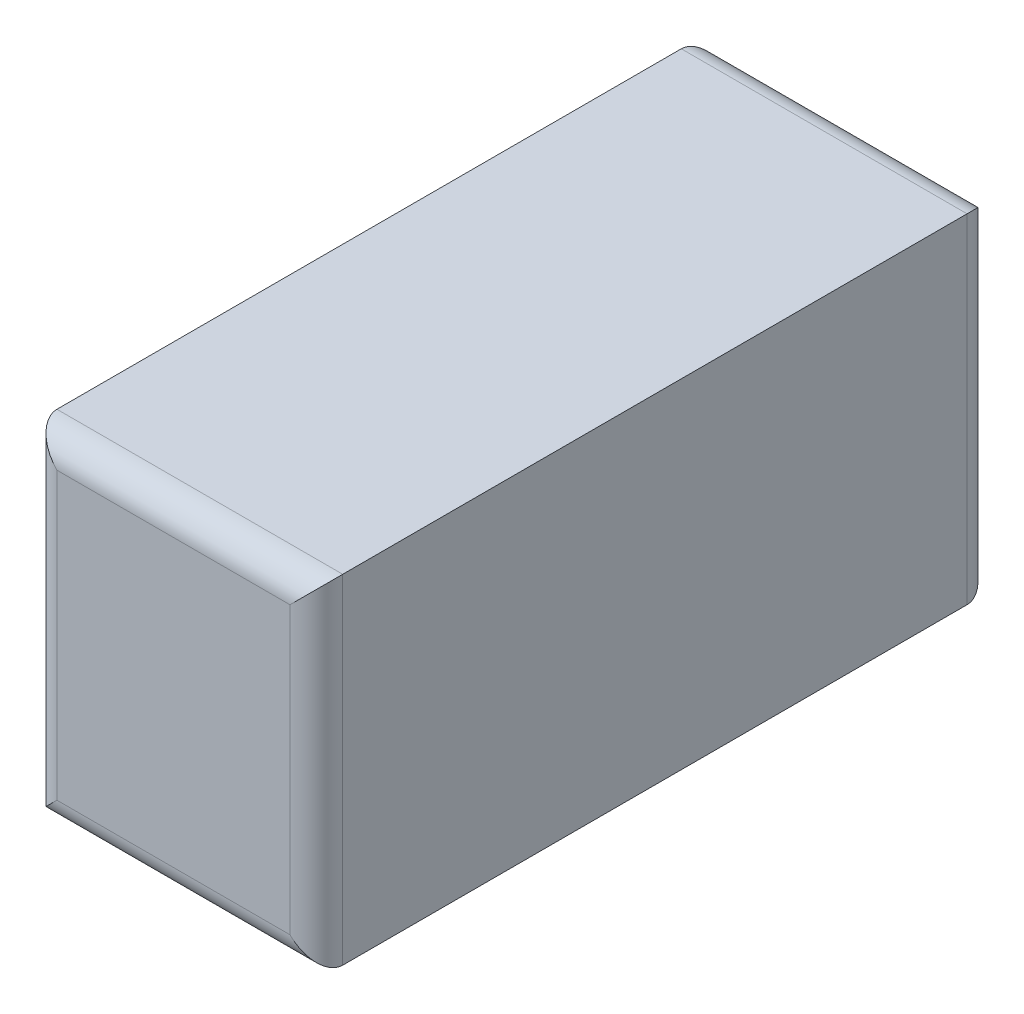
from build123d import *

# Parameters (mm, degrees)
SKETCH1_W           = 32.5
SKETCH1_H           = 38.5
BOSS_EXTRUDE1_DEPTH = 77
FILLET1_R           = 3


with BuildPart() as part:
    # Sketch1 → Boss-Extrude1 (new body)
    with BuildSketch(Plane.XY):
        with Locations((16.25, 19.25)):
            Rectangle(SKETCH1_W, SKETCH1_H)
    extrude(amount=BOSS_EXTRUDE1_DEPTH)

    # Fillet1
    fillet1_edges = [part.edges().sort_by_distance(p)[0] for p in [
        (16.25, 38.5, 77),
        (32.5, 19.25, 77),
        (16.25, 0, 77),
        (0, 19.25, 77),
        (16.25, 0, 0),
        (32.5, 19.25, 0),
        (16.25, 38.5, 0),
        (0, 19.25, 0),
    ]]
    fillet(fillet1_edges, radius=FILLET1_R)


solid = part.part
